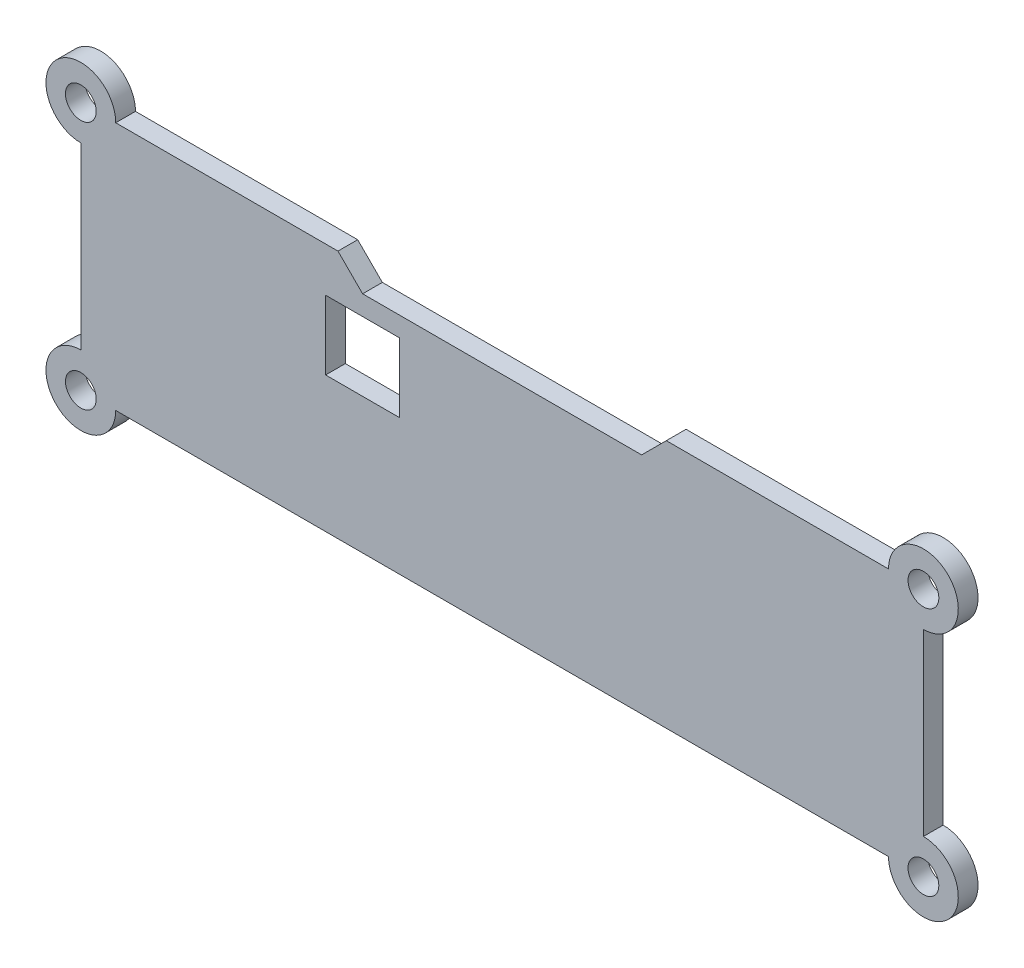
from build123d import *

# Parameters (mm, degrees)
SKETCH1_R           = 1.56
BOSS_EXTRUDE1_DEPTH = 2
CUT_EXTRUDE1_REACH  = 78.11
SKETCH2_W           = 7.5
SKETCH2_H           = 7


with BuildPart() as part:
    # Sketch1 → Boss-Extrude1 (new body)
    with BuildSketch(Plane.XY):
        with BuildLine():
            Line((16.640533906, -31.638268735), (39.16446609, -31.638268735))
            ThreePointArc((39.16446609, -31.638268735), (45.200000003, -29.138268732), (42.7, -35.173802645))
            Line((42.7, -35.173802645), (42.7, -53.352734825))
            ThreePointArc((42.7, -53.352734825), (45.200000003, -59.388268738), (39.16446609, -56.888268735))
            Line((39.16446609, -56.888268735), (-39.16446609, -56.888268735))
            ThreePointArc((-39.16446609, -56.888268735), (-45.200000003, -59.388268738), (-42.7, -53.352734825))
            Line((-42.7, -53.352734825), (-42.7, -35.173802645))
            ThreePointArc((-42.7, -35.173802645), (-45.200000003, -29.138268732), (-39.16446609, -31.638268735))
            Line((-39.16446609, -31.638268735), (-16.640533906, -31.638268735))
            Line((-16.640533906, -31.638268735), (-14.140533906, -34.138268735))
            Line((-14.140533906, -34.138268735), (14.140533906, -34.138268735))
            Line((14.140533906, -34.138268735), (16.640533906, -31.638268735))
        make_face()
        with Locations((-42.7, -31.638268735)):
            Circle(SKETCH1_R, mode=Mode.SUBTRACT)
        with Locations((-42.7, -56.888268735)):
            Circle(SKETCH1_R, mode=Mode.SUBTRACT)
        with Locations((42.7, -56.888268735)):
            Circle(SKETCH1_R, mode=Mode.SUBTRACT)
        with Locations((42.7, -31.638268735)):
            Circle(SKETCH1_R, mode=Mode.SUBTRACT)
    extrude(amount=BOSS_EXTRUDE1_DEPTH)

    # Sketch2 → Cut-Extrude1 (cut, up to next)
    with BuildSketch(Plane.XY.offset(2), mode=Mode.PRIVATE) as cut_extrude1_sk1:
        with Locations((-14.140533906, -39.638268735)):
            Rectangle(SKETCH2_W, SKETCH2_H)
    cut_extrude1_tool1 = extrude(cut_extrude1_sk1.sketch, amount=-CUT_EXTRUDE1_REACH, mode=Mode.PRIVATE) & part.part
    add(cut_extrude1_tool1.solids().sort_by_distance((-14.140534, -39.638269, 2))[0], mode=Mode.SUBTRACT)


solid = part.part
